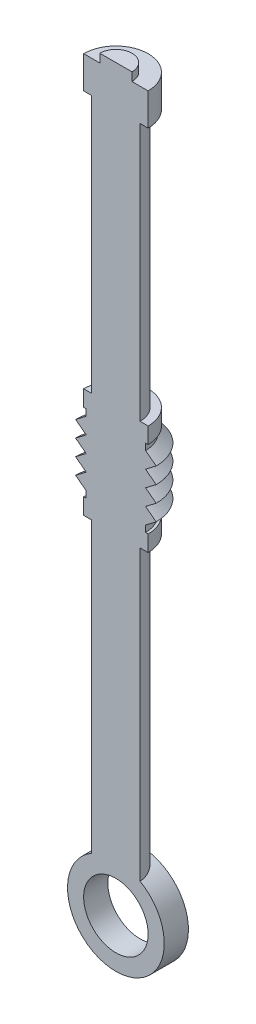
from build123d import *
from build123d.topology import SkipClean

# Parameters (mm, degrees)
BOSS_EXTRUDE1_DEPTH                  = 4.7625
BOSS_EXTRUDE1_DEPTH_BACK             = 2.38125
SKETCH1_R                            = 4.7625
SKETCH1_R_2                          = 3.175
SKETCH2_R                            = 2.38125
BOSS_EXTRUDE2_DEPTH                  = 28.575
BOSS_EXTRUDE2_DIRECTION_2_REACH      = 13.666
BOSS_EXTRUDE2_DIRECTION_2_END_RADIUS = 4.7625
BOSS_EXTRUDE3_START                  = 25.4
SKETCH4_R                            = 2.38125
BOSS_EXTRUDE3_DEPTH                  = 25.4
SKETCH5_R                            = 3.175
BOSS_EXTRUDE4_DEPTH                  = 3.175
SKETCH6_R                            = 1.5875
BOSS_EXTRUDE5_DEPTH                  = 0.83185
SKETCH7_W                            = 15.534712676
SKETCH7_H                            = 81.822586025
CUT_EXTRUDE1_DEPTH                   = 74.056725452


with BuildPart() as part:
    # Sketch1 → Boss-Extrude1 (new, two sides: drawn at the far end of the back side and taken through both)
    with BuildSketch(Plane.XY.offset(-BOSS_EXTRUDE1_DEPTH_BACK)):
        Circle(SKETCH1_R)
        Circle(SKETCH1_R_2, mode=Mode.SUBTRACT)
    extrude(amount=BOSS_EXTRUDE1_DEPTH + BOSS_EXTRUDE1_DEPTH_BACK)

    # Sketch2 → Boss-Extrude2 (add)
    with BuildSketch(Plane(origin=(0, 4.7625, 0), x_dir=(1, 0, 0), z_dir=(0, 1, 0))):
        Circle(SKETCH2_R)
    extrude(amount=BOSS_EXTRUDE2_DEPTH)

    # Boss-Extrude2 direction 2: up to this cylinder (the profile starts outside it)
    boss_extrude2_direction_2_end = Plane(origin=(0, 0, 0), z_dir=(0, 0, 1)) * Cylinder(BOSS_EXTRUDE2_DIRECTION_2_END_RADIUS, 37.857, mode=Mode.PRIVATE)
    # Sketch2 → Boss-Extrude2 direction 2 (add, up to the surface)
    with BuildSketch(Plane(origin=(0, 4.7625, 0), x_dir=(1, 0, 0), z_dir=(0, 1, 0)), mode=Mode.PRIVATE) as boss_extrude2_direction_2_sk1:
        Circle(SKETCH2_R)
    boss_extrude2_direction_2_tool1 = extrude(boss_extrude2_direction_2_sk1.sketch, amount=-BOSS_EXTRUDE2_DIRECTION_2_REACH, mode=Mode.PRIVATE) - boss_extrude2_direction_2_end
    add(boss_extrude2_direction_2_tool1.solids().sort_by_distance((0, 4.7625, 0))[0])
    add(boss_extrude2_direction_2_tool1.solids().sort_by_distance((0, 4.7625, 0))[1])

    # Sketch3 → Revolve1 (revolve)
    with SkipClean():  # the faces are left unmerged after this step: merging them gives an invalid solid
        with BuildSketch(Plane(origin=(0, 0, 0), x_dir=(0, 0, -1), z_dir=(1, 0, 0))):
            Polygon((-2.921, 34.76625), (-2.921, 34.13125), (-3.175, 34.13125), (-3.175, 32.54375), (0, 32.54375), (0, 43.33875), (-3.175, 43.33875), (-3.175, 41.75125), (-2.921, 41.75125), (-2.921, 41.11625), (-3.96875, 40.3225), (-2.921, 39.52875), (-3.96875, 38.735), (-2.921, 37.94125), (-3.96875, 37.1475), (-2.921, 36.35375), (-3.96875, 35.56), align=None)
        revolve(axis=Axis((0, 32.54375, 0), (0, 1, 0)))

    # Sketch4 → Boss-Extrude3 (add)
    with SkipClean():  # the faces are left unmerged after this step: merging them gives an invalid solid
        with BuildSketch(Plane(origin=(0, 43.33875, 0), x_dir=(1, 0, 0), z_dir=(0, 1, 0)).offset(BOSS_EXTRUDE3_START)):
            Circle(SKETCH4_R)
        extrude(amount=-BOSS_EXTRUDE3_DEPTH)

    # Sketch5 → Boss-Extrude4 (add)
    with SkipClean():  # the faces are left unmerged after this step: merging them gives an invalid solid
        with BuildSketch(Plane(origin=(0, 68.73875, 0), x_dir=(1, 0, 0), z_dir=(0, 1, 0))):
            Circle(SKETCH5_R)
        extrude(amount=BOSS_EXTRUDE4_DEPTH)

    # Sketch6 → Boss-Extrude5 (add)
    with SkipClean():  # the faces are left unmerged after this step: merging them gives an invalid solid
        with BuildSketch(Plane(origin=(0, 71.91375, 0), x_dir=(1, 0, 0), z_dir=(0, 1, 0))):
            Circle(SKETCH6_R)
        extrude(amount=BOSS_EXTRUDE5_DEPTH)

    # Sketch7 → Cut-Extrude1 (cut, through all)
    with SkipClean():  # the faces are left unmerged after this step: merging them gives an invalid solid
        with BuildSketch(Plane.XY):
            with Locations((0.627177841, 34.425750044)):
                Rectangle(SKETCH7_W, SKETCH7_H)
        extrude(amount=CUT_EXTRUDE1_DEPTH, mode=Mode.SUBTRACT)


solid = part.part
